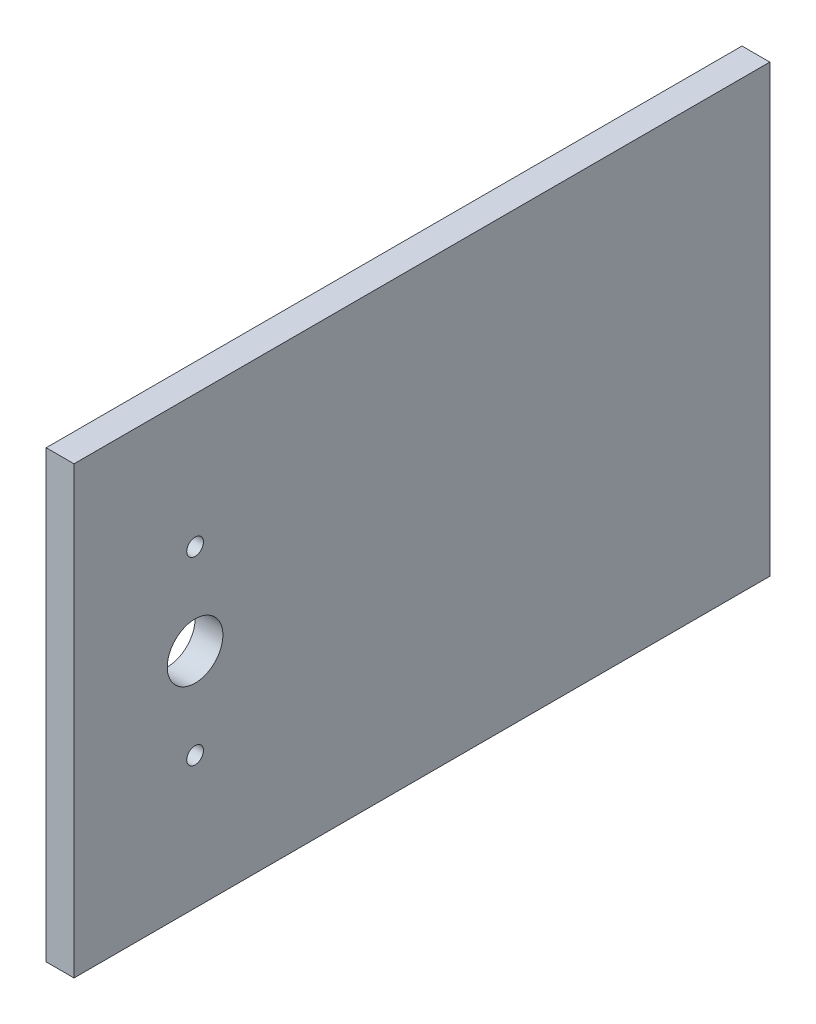
from build123d import *

# Parameters (mm, degrees)
SKETCH1_W           = 80
SKETCH1_H           = 125
SKETCH1_R           = 5
SKETCH1_R_2         = 1.5
BOSS_EXTRUDE1_DEPTH = 5


with BuildPart() as part:
    # Sketch1 → Boss-Extrude1 (new body)
    with BuildSketch(Plane.YZ):
        Rectangle(SKETCH1_W, SKETCH1_H)
        with Locations((0, 40.75)):
            Circle(SKETCH1_R, mode=Mode.SUBTRACT)
        with Locations((-16.22, 40.75)):
            Circle(SKETCH1_R_2, mode=Mode.SUBTRACT)
        with Locations((16.22, 40.75)):
            Circle(SKETCH1_R_2, mode=Mode.SUBTRACT)
    extrude(amount=BOSS_EXTRUDE1_DEPTH)


solid = part.part
